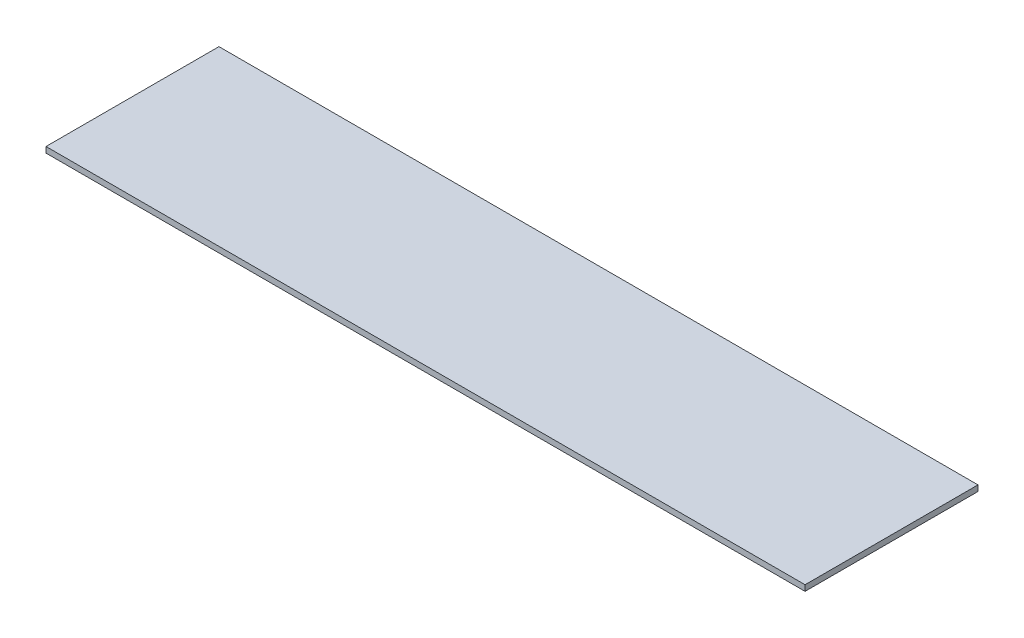
from build123d import *

# Parameters (mm, degrees)
SKETCH1_W           = 790
SKETCH1_H           = 90
BOSS_EXTRUDE1_DEPTH = 3
SPLIT1_START        = 357.422709601
SPLIT1_OUTLINE_W    = 3
SPLIT1_OUTLINE_H    = 90
SPLIT1_DEPTH        = 395


# Read off the part's stored shape, not the designer's step: Split1
with BuildPart() as part:
    # Sketch1 → Boss-Extrude1 (new body)
    with BuildSketch(Plane(origin=(0, 0, 0), x_dir=(1, 0, 0), z_dir=(0, 1, 0))):
        with Locations((357.422709601, 42.901940756)):
            Rectangle(SKETCH1_W, SKETCH1_H)
    extrude(amount=BOSS_EXTRUDE1_DEPTH)

    # Split1 outline → Split1 (cut)
    with BuildSketch(Plane.YZ.offset(SPLIT1_START)):
        with Locations((1.5, -42.901940756)):
            Rectangle(SPLIT1_OUTLINE_W, SPLIT1_OUTLINE_H)
    extrude(amount=SPLIT1_DEPTH, mode=Mode.SUBTRACT)


solid = part.part
